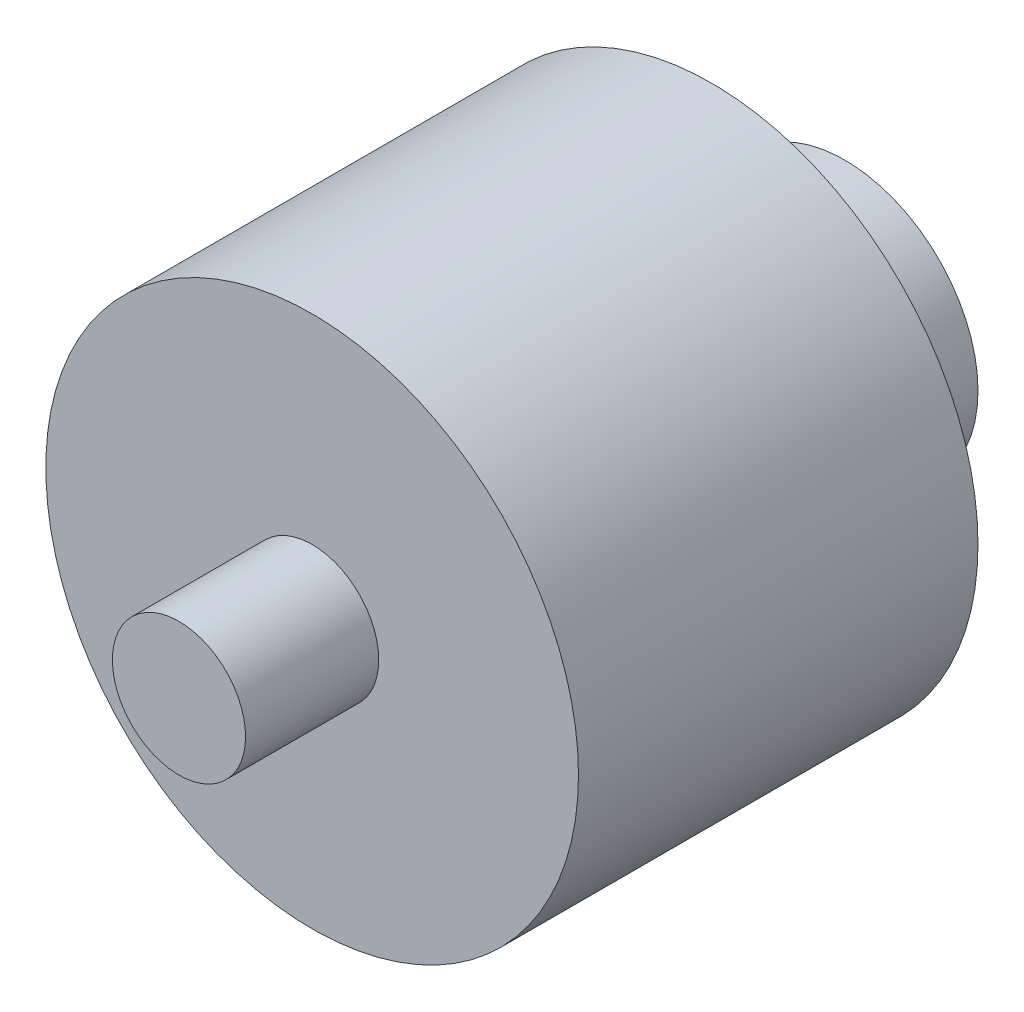
from build123d import *

# Parameters (mm, degrees)
SKETCH1_R           = 6
SKETCH1_R_2         = 3
BOSS_EXTRUDE1_DEPTH = 6
SKETCH2_R           = 12
BOSS_EXTRUDE3_DEPTH = 18
SKETCH3_R           = 3
BOSS_EXTRUDE4_DEPTH = 6


with BuildPart() as part:
    # Sketch1 → Boss-Extrude1 (new body)
    with BuildSketch(Plane.XY):
        Circle(SKETCH1_R)
        Circle(SKETCH1_R_2, mode=Mode.SUBTRACT)
    extrude(amount=BOSS_EXTRUDE1_DEPTH)

    # Sketch2 → Boss-Extrude3 (add)
    with BuildSketch(Plane.XY.offset(6)):
        Circle(SKETCH2_R)
    extrude(amount=BOSS_EXTRUDE3_DEPTH)

    # Sketch3 → Boss-Extrude4 (add)
    with BuildSketch(Plane.XY.offset(24)):
        Circle(SKETCH3_R)
    extrude(amount=BOSS_EXTRUDE4_DEPTH)


solid = part.part
